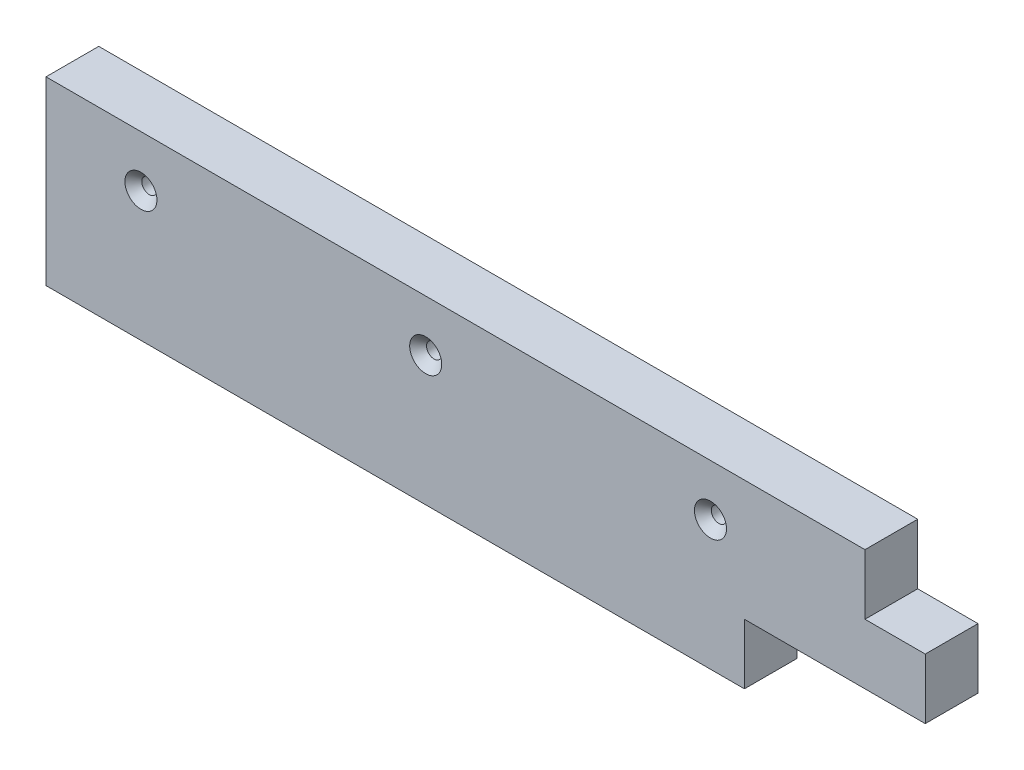
from build123d import *

# Parameters (mm, degrees)
SKETCH1_W                                            = 370.50412818
SKETCH1_H                                            = 22.225
BOSS_EXTRUDE1_DEPTH                                  = 38.1
CSK_FOR_M6_HEX_SOCKET_COUNTERSUNK_HEAD_S_D           = 6.4
CSK_FOR_M6_HEX_SOCKET_COUNTERSUNK_HEAD_S_CSINK_D     = 13.5
CSK_FOR_M6_HEX_SOCKET_COUNTERSUNK_HEAD_S_CSINK_ANGLE = 90
SKETCH3_W                                            = 25.4
SKETCH3_H                                            = 25.4
SKETCH3_W_2                                          = 76.2
CUT_EXTRUDE1_DEPTH                                   = 191.4307955


with BuildPart() as part:
    # Sketch1 → Boss-Extrude1 (new, symmetric)
    with BuildSketch(Plane(origin=(0, 0, 0), x_dir=(1, 0, 0), z_dir=(0, 1, 0))):
        Rectangle(SKETCH1_W, SKETCH1_H)
    extrude(amount=BOSS_EXTRUDE1_DEPTH, both=True)

    # CSK for M6 Hex Socket Countersunk Head Screw6 (through all)
    with Locations(Plane.XY.offset(11.1125)):
        with Locations((-145.252063961, 16.50746), (-25.252063961, 16.50746), (94.747936039, 16.50746)):
            CounterSinkHole(CSK_FOR_M6_HEX_SOCKET_COUNTERSUNK_HEAD_S_D / 2, CSK_FOR_M6_HEX_SOCKET_COUNTERSUNK_HEAD_S_CSINK_D / 2, counter_sink_angle=CSK_FOR_M6_HEX_SOCKET_COUNTERSUNK_HEAD_S_CSINK_ANGLE)

    # Sketch3 → Cut-Extrude1 (cut, through all)
    with BuildSketch(Plane.XY.offset(11.1125)):
        with Locations((172.55206409, 25.4)):
            Rectangle(SKETCH3_W, SKETCH3_H)
        with Locations((147.15206409, -25.4)):
            Rectangle(SKETCH3_W_2, SKETCH3_H)
    extrude(amount=-CUT_EXTRUDE1_DEPTH, mode=Mode.SUBTRACT)


solid = part.part
